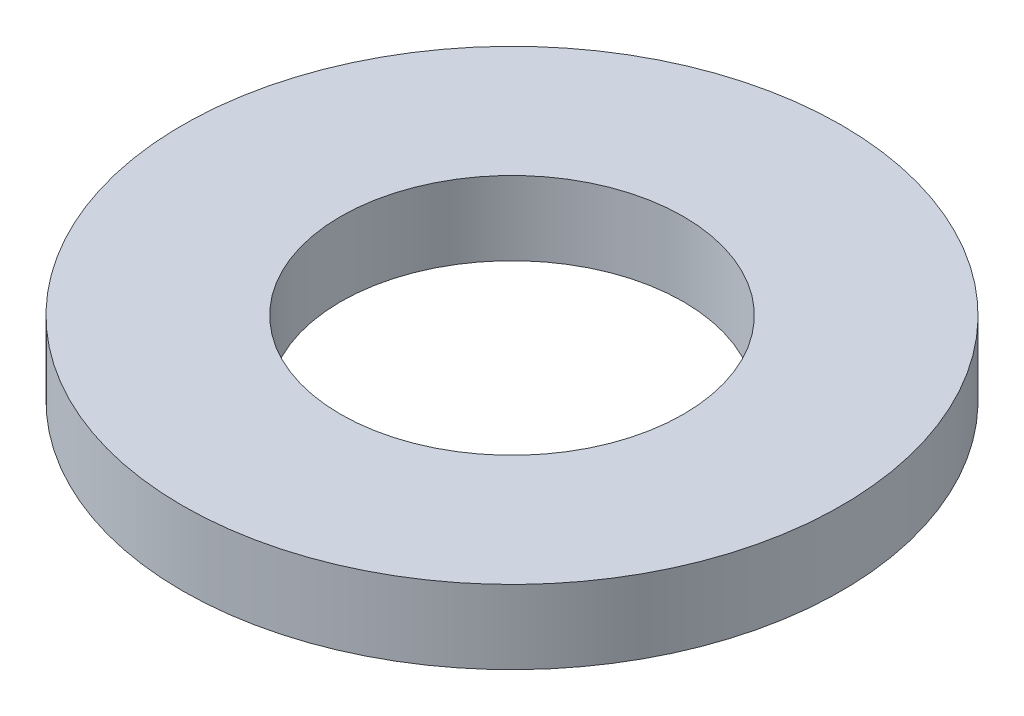
from build123d import *

# Parameters (mm, degrees)
SKETCH1_R           = 62.5
BOSS_EXTRUDE1_DEPTH = 14
SKETCH2_R           = 32.5
CUT_EXTRUDE1_DEPTH  = 90.49022293


with BuildPart() as part:
    # Sketch1 → Boss-Extrude1 (new body)
    with BuildSketch(Plane(origin=(0, 0, 0), x_dir=(1, 0, 0), z_dir=(0, 1, 0))):
        Circle(SKETCH1_R)
    extrude(amount=BOSS_EXTRUDE1_DEPTH)

    # Sketch2 → Cut-Extrude1 (cut, through all)
    with BuildSketch(Plane(origin=(0, 0, 0), x_dir=(1, 0, 0), z_dir=(0, 1, 0))):
        Circle(SKETCH2_R)
    extrude(amount=CUT_EXTRUDE1_DEPTH, mode=Mode.SUBTRACT)


solid = part.part
